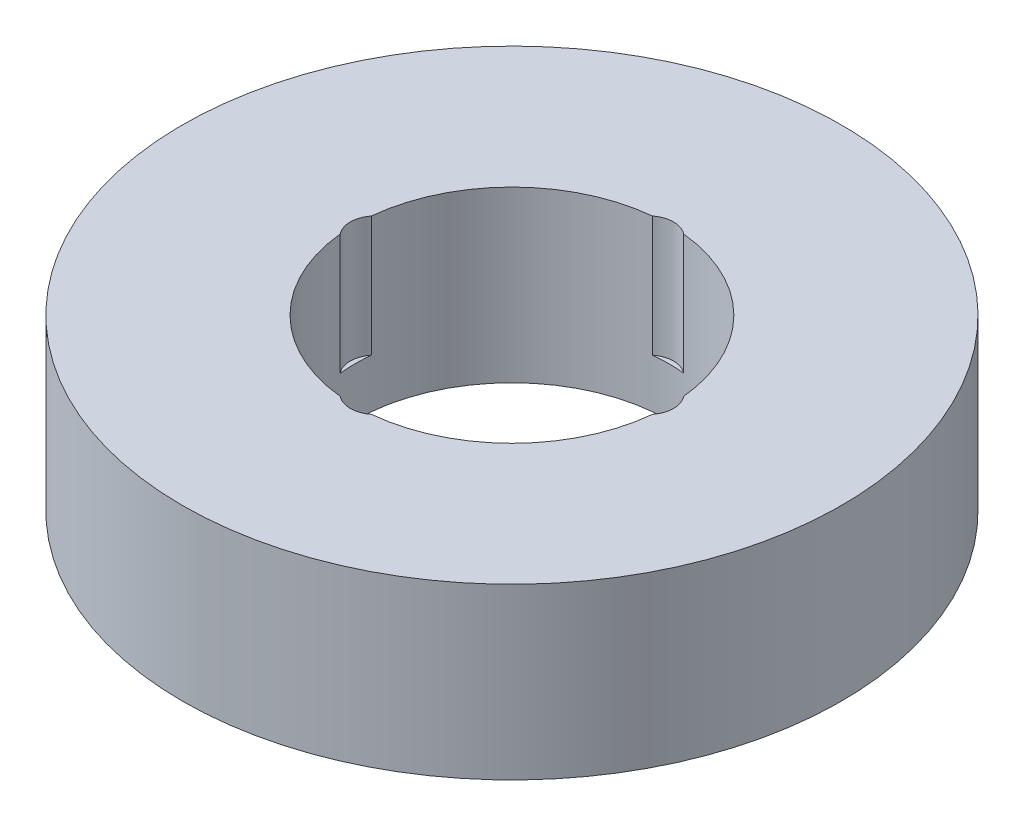
from build123d import *

# Parameters (mm, degrees)
SKETCH1_R           = 52.5
BOSS_EXTRUDE1_DEPTH = 27
SKETCH2_R           = 25
CUT_EXTRUDE1_DEPTH  = 80.003164494
SKETCH3_R           = 4.003104305
CUT_EXTRUDE2_DEPTH  = 19.193368267
CIRPATTERN1_COUNT   = 4


with BuildPart() as part:
    # Sketch1 → Boss-Extrude1 (new body)
    with BuildSketch(Plane(origin=(0, 0, 0), x_dir=(1, 0, 0), z_dir=(0, 1, 0))):
        Circle(SKETCH1_R)
    extrude(amount=BOSS_EXTRUDE1_DEPTH)

    # Sketch2 → Cut-Extrude1 (cut, through all)
    with BuildSketch(Plane(origin=(0, 0, 0), x_dir=(1, 0, 0), z_dir=(0, 1, 0))):
        Circle(SKETCH2_R)
    extrude(amount=CUT_EXTRUDE1_DEPTH, mode=Mode.SUBTRACT)

    # Sketch3 → Cut-Extrude2 (cut)
    with BuildSketch(Plane(origin=(0, 27, 0), x_dir=(1, 0, 0), z_dir=(0, 1, 0))):
        with Locations((-21.738149228, 0)):
            Circle(SKETCH3_R)
    cut_extrude2 = extrude(amount=-CUT_EXTRUDE2_DEPTH, mode=Mode.SUBTRACT)

    # CirPattern1: Cut-Extrude2 ×4 about axis
    cirpattern1_axis = Axis((0, 0, 0), (0, 1, 0))
    for i in range(1, CIRPATTERN1_COUNT):
        add(cut_extrude2.rotate(cirpattern1_axis, i * 360 / CIRPATTERN1_COUNT), mode=Mode.SUBTRACT)


solid = part.part
